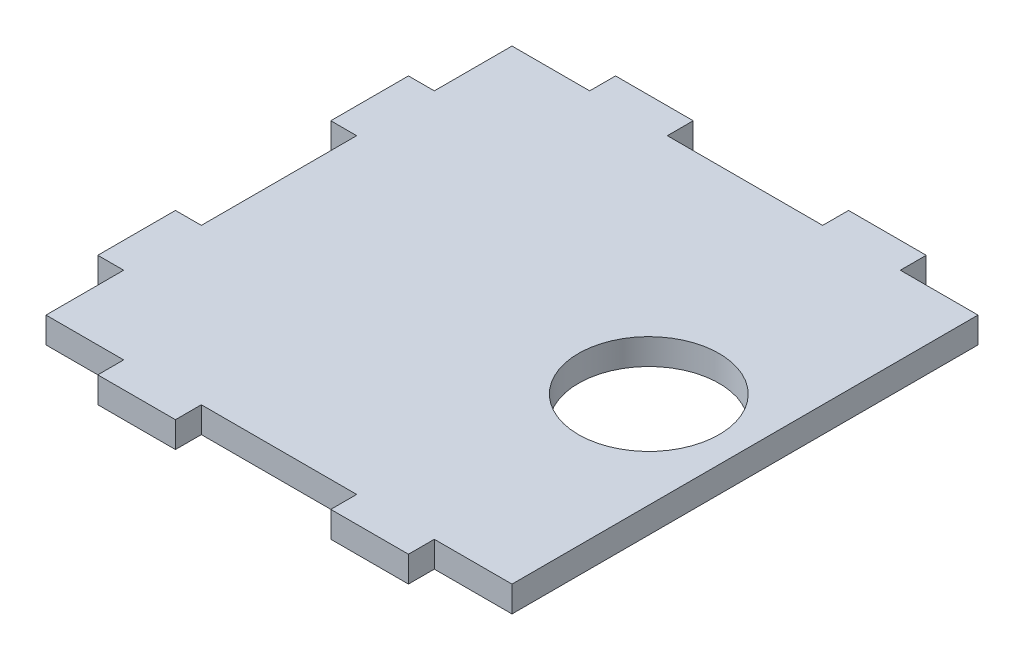
from build123d import *

# Parameters (mm, degrees)
BOSS_EXTRUDE1_DEPTH = 6.35
SKETCH2_R           = 17.250029
CUT_EXTRUDE1_DEPTH  = 167.316670842


with BuildPart() as part:
    # Sketch1 → Boss-Extrude1 (new body)
    with BuildSketch(Plane(origin=(0, 0, 0), x_dir=(1, 0, 0), z_dir=(0, 1, 0))):
        Polygon((0, 0), (19.05, 0), (19.05, -6.35), (38.1, -6.35), (38.1, 0), (76.2, 0), (76.2, -6.35), (95.25, -6.35), (95.25, 0), (114.3, 0), (114.3, 114.3), (95.25, 114.3), (95.25, 120.65), (76.2, 120.65), (76.2, 114.3), (38.1, 114.3), (38.1, 120.65), (19.05, 120.65), (19.05, 114.3), (0, 114.3), (0, 95.25), (-6.35, 95.25), (-6.35, 76.2), (0, 76.2), (0, 38.1), (-6.35, 38.1), (-6.35, 19.05), (0, 19.05), align=None)
    extrude(amount=-BOSS_EXTRUDE1_DEPTH)

    # Sketch2 → Cut-Extrude1 (cut, through all)
    with BuildSketch(Plane(origin=(0, 0, 0), x_dir=(1, 0, 0), z_dir=(0, 1, 0))):
        with Locations((90.699971, 57.15)):
            Circle(SKETCH2_R)
    extrude(amount=-CUT_EXTRUDE1_DEPTH, mode=Mode.SUBTRACT)


solid = part.part
